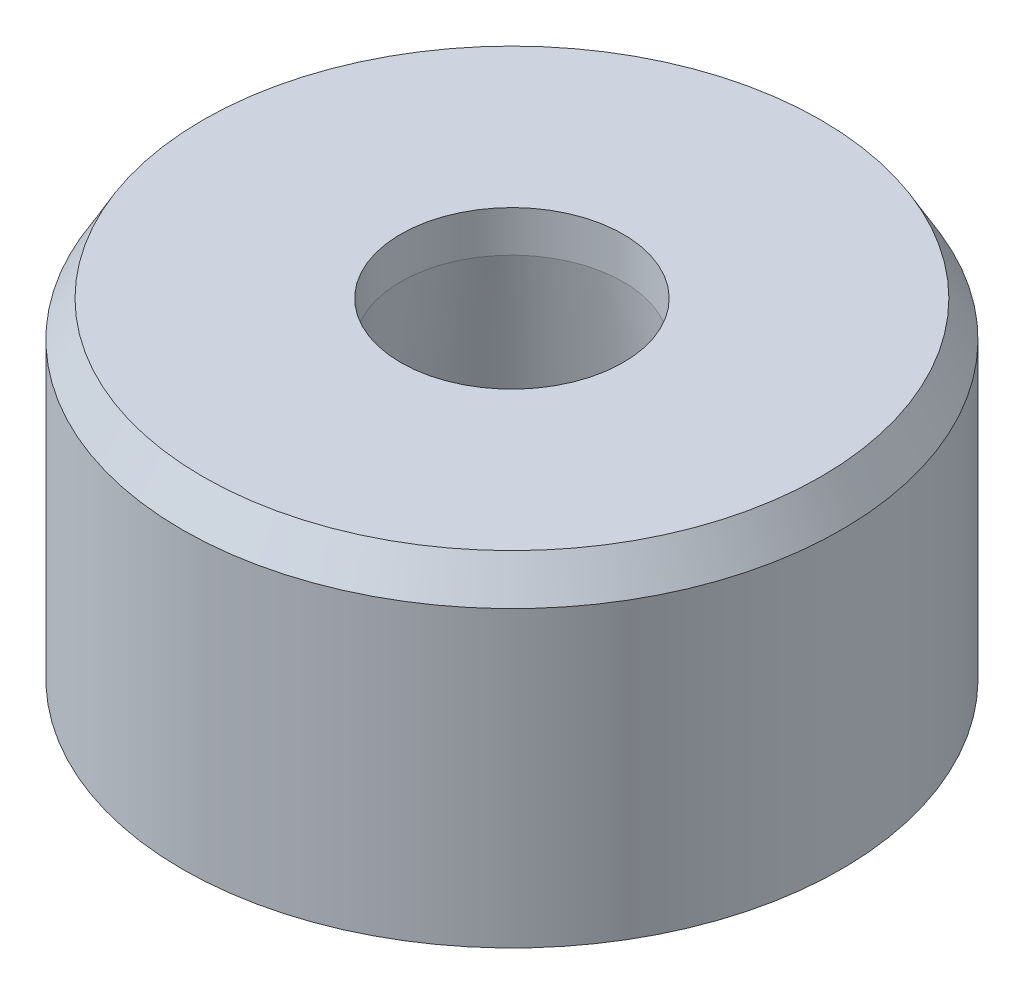
from build123d import *

# Parameters (mm, degrees)
SKETCH1_R           = 8
SKETCH1_R_2         = 2.7
BOSS_EXTRUDE1_DEPTH = 8
CHAMFER1_SIZE       = 7
CHAMFER1_SIZE2      = 0.983785843
CHAMFER2_SIZE       = 0.5
CHAMFER2_SIZE2      = 0.866025404


with BuildPart() as part:
    # Sketch1 → Boss-Extrude1 (new body)
    with BuildSketch(Plane(origin=(0, 0, 0), x_dir=(1, 0, 0), z_dir=(0, 1, 0))):
        Circle(SKETCH1_R)
        Circle(SKETCH1_R_2, mode=Mode.SUBTRACT)
    extrude(amount=BOSS_EXTRUDE1_DEPTH)

    # Chamfer1
    chamfer1_edges = [part.edges().sort_by_distance(p)[0] for p in [
        (-2.7, 0, 0),
    ]]
    chamfer1_side = [part.faces().sort_by_distance(p)[0] for p in [
        (-2.7, 4, 0),
    ]]
    chamfer(chamfer1_edges, length=CHAMFER1_SIZE, length2=CHAMFER1_SIZE2, reference=chamfer1_side[0])

    # Chamfer2
    chamfer2_edges = [part.edges().sort_by_distance(p)[0] for p in [
        (-8, 8, 0),
    ]]
    chamfer2_side = [part.faces().sort_by_distance(p)[0] for p in [
        (-7.77372583, 8, 0),
    ]]
    chamfer(chamfer2_edges, length=CHAMFER2_SIZE, length2=CHAMFER2_SIZE2, reference=chamfer2_side[0])


solid = part.part
